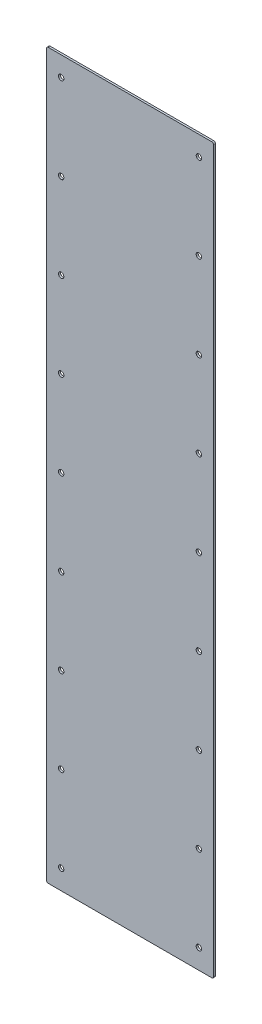
from build123d import *

# Parameters (mm, degrees)
SKETCH1_W            = 170
SKETCH1_H            = 736
BASE_FLANGE1_DEPTH   = 2
M5_CLEARANCE_HOLE1_D = 5.5
CRVPATTERN1_COUNT    = 9
CRVPATTERN1_PITCH    = 87
MIRROR1_COPY_1_D     = 5.5
MIRROR1_COPY_2_D     = 5.5
MIRROR1_COPY_3_D     = 5.5
MIRROR1_COPY_4_D     = 5.5
MIRROR1_COPY_5_D     = 5.5
MIRROR1_COPY_6_D     = 5.5
MIRROR1_COPY_7_D     = 5.5
MIRROR1_COPY_8_D     = 5.5
FILLET1_R            = 2


# Sheet-metal steps are written as plain solids
with BuildPart() as part:
    # Sketch1 → Base-Flange1 (new body)
    with BuildSketch(Plane.XY):
        Rectangle(SKETCH1_W, SKETCH1_H)
    extrude(amount=-BASE_FLANGE1_DEPTH)

    # M5 Clearance Hole1 (through all)
    with Locations(Plane(origin=(0, 0, -2), x_dir=(-1, 0, 0), z_dir=(0, 0, -1))):
        with Locations((-70, -348)):
            m5_clearance_hole1 = Hole(M5_CLEARANCE_HOLE1_D / 2)

    # CrvPattern1: M5 Clearance Hole1 ×9
    with Locations(*[(0, i * CRVPATTERN1_PITCH, 0) for i in range(1, CRVPATTERN1_COUNT)]):
        add(m5_clearance_hole1, mode=Mode.SUBTRACT)

    # Mirror1: M5 Clearance Hole1 across plane
    add(m5_clearance_hole1.mirror(Plane(origin=(0, 0, 0), x_dir=(0, 0, 1), z_dir=(1, 0, 0))), mode=Mode.SUBTRACT)

    # Mirror1 copy 1 (through all)
    with Locations(Plane(origin=(0, 87, -2), x_dir=(1, 0, 0), z_dir=(0, 0, -1))):
        with Locations((-70, 348)):
            Hole(MIRROR1_COPY_1_D / 2)

    # Mirror1 copy 2 (through all)
    with Locations(Plane(origin=(0, 174, -2), x_dir=(1, 0, 0), z_dir=(0, 0, -1))):
        with Locations((-70, 348)):
            Hole(MIRROR1_COPY_2_D / 2)

    # Mirror1 copy 3 (through all)
    with Locations(Plane(origin=(0, 261, -2), x_dir=(1, 0, 0), z_dir=(0, 0, -1))):
        with Locations((-70, 348)):
            Hole(MIRROR1_COPY_3_D / 2)

    # Mirror1 copy 4 (through all)
    with Locations(Plane(origin=(0, 348, -2), x_dir=(1, 0, 0), z_dir=(0, 0, -1))):
        with Locations((-70, 348)):
            Hole(MIRROR1_COPY_4_D / 2)

    # Mirror1 copy 5 (through all)
    with Locations(Plane(origin=(0, 435, -2), x_dir=(1, 0, 0), z_dir=(0, 0, -1))):
        with Locations((-70, 348)):
            Hole(MIRROR1_COPY_5_D / 2)

    # Mirror1 copy 6 (through all)
    with Locations(Plane(origin=(0, 522, -2), x_dir=(1, 0, 0), z_dir=(0, 0, -1))):
        with Locations((-70, 348)):
            Hole(MIRROR1_COPY_6_D / 2)

    # Mirror1 copy 7 (through all)
    with Locations(Plane(origin=(0, 609, -2), x_dir=(1, 0, 0), z_dir=(0, 0, -1))):
        with Locations((-70, 348)):
            Hole(MIRROR1_COPY_7_D / 2)

    # Mirror1 copy 8 (through all)
    with Locations(Plane(origin=(0, 696, -2), x_dir=(1, 0, 0), z_dir=(0, 0, -1))):
        with Locations((-70, 348)):
            Hole(MIRROR1_COPY_8_D / 2)

    # Fillet1
    fillet1_edges = [part.edges().sort_by_distance(p)[0] for p in [
        (-85, 368, -1),
        (85, 368, -1),
        (85, -368, -1),
        (-85, -368, -1),
    ]]
    fillet(fillet1_edges, radius=FILLET1_R)


solid = part.part
